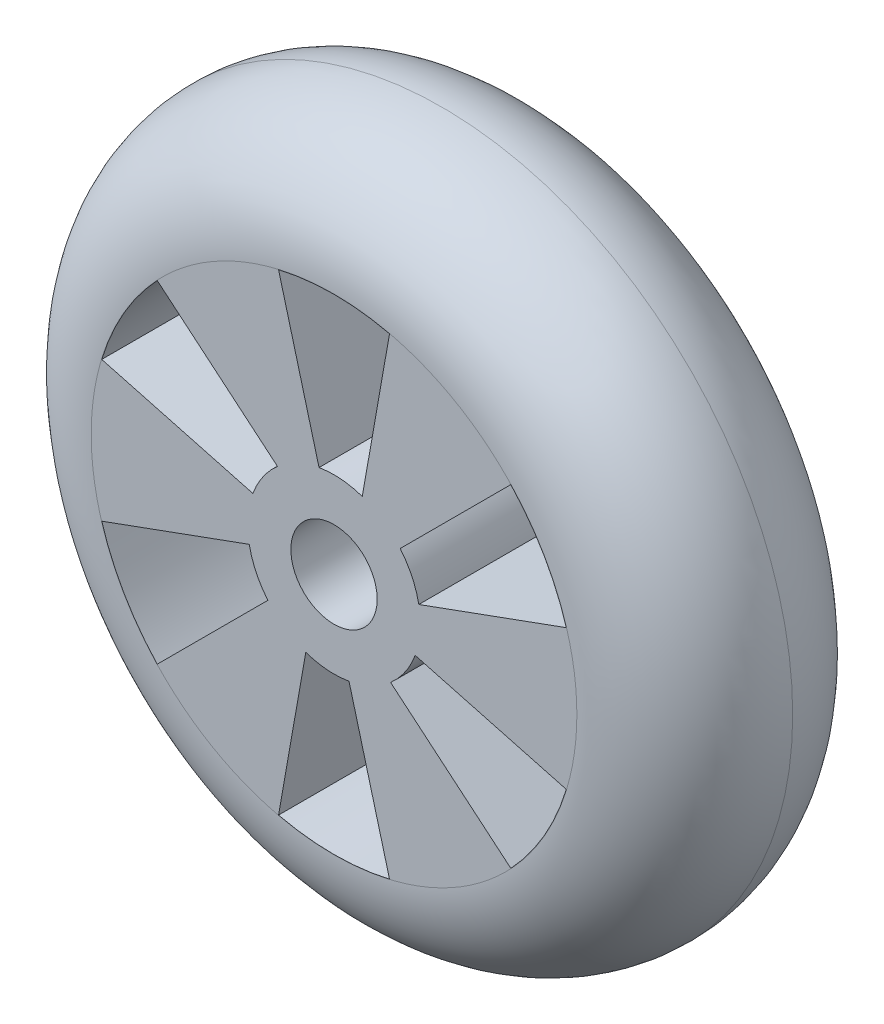
from build123d import *

# Parameters (mm, degrees)
SKETCH_1_R               = 32.5
SKETCH_1_R_2             = 4
EXTRUDE_1_DEPTH          = 20
FILLET_1_R               = 10
CUT_EXTRUDE_1_DEPTH      = 20
PATTERN_CIRCULAR_1_COUNT = 6


with BuildPart() as part:
    # 草图1 → 凸台-拉伸1 (new body)
    with BuildSketch(Plane.XY):
        Circle(SKETCH_1_R)
        Circle(SKETCH_1_R_2, mode=Mode.SUBTRACT)
    extrude(amount=EXTRUDE_1_DEPTH)

    # 圆角1
    fillet_1_edges = [part.edges().sort_by_distance(p)[0] for p in [
        (-32.5, 0, 0),
        (-32.5, 0, 20),
    ]]
    fillet(fillet_1_edges, radius=FILLET_1_R - 0.0001)  # a hair under: the kernel refuses the full size

    # 草图2 → 切除-拉伸1 (cut)
    with BuildSketch(Plane.XY.offset(20)):
        with BuildLine():
            Line((-5.142061575, 21.884386505), (-1.389185421, 7.878462024))
            ThreePointArc((-1.389185421, 7.878462024), (0.633872, 7.974848355), (2.616301677, 7.560090313))
            Line((2.616301677, 7.560090313), (5.142061575, 21.884386505))
            ThreePointArc((5.142061575, 21.884386505), (0, 22.480372994), (-5.142061575, 21.884386505))
        make_face()
    cut_extrude_1 = extrude(amount=-CUT_EXTRUDE_1_DEPTH, mode=Mode.SUBTRACT)

    # 阵列(圆周)1: 切除-拉伸1 ×6 about axis
    pattern_circular_1_axis = Axis((0, 0, 0), (0, 0, 1))
    for i in range(1, PATTERN_CIRCULAR_1_COUNT):
        add(cut_extrude_1.rotate(pattern_circular_1_axis, i * 360 / PATTERN_CIRCULAR_1_COUNT), mode=Mode.SUBTRACT)


solid = part.part
